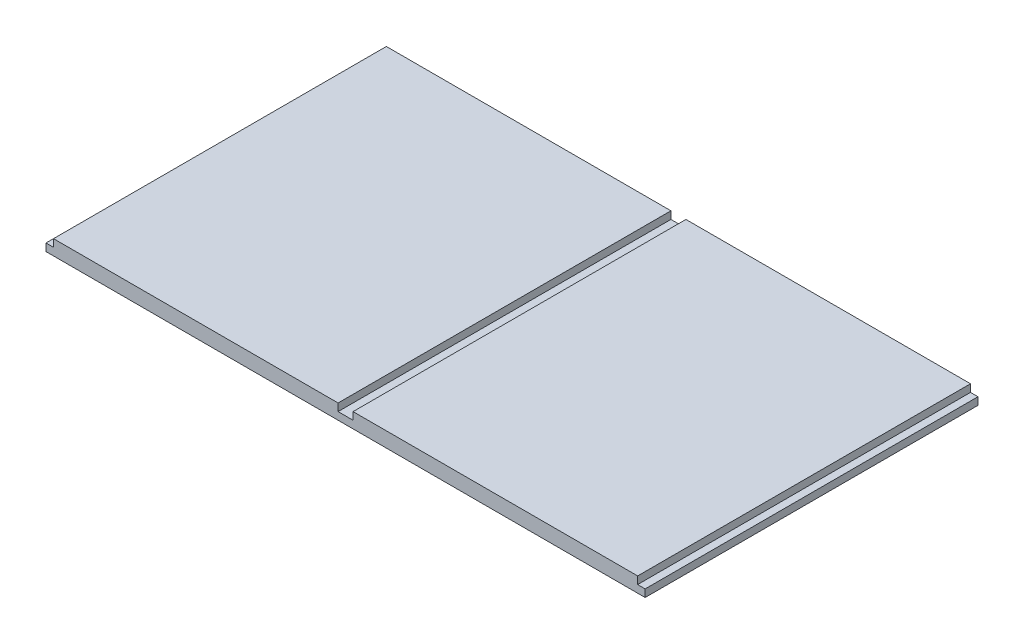
from build123d import *

# Parameters (mm, degrees)
SKETCH1_W           = 720
SKETCH1_H           = 400
BOSS_EXTRUDE1_DEPTH = 18
SKETCH2_W           = 9
SKETCH2_H           = 400
CUT_EXTRUDE1_DEPTH  = 9
SKETCH3_W           = 18
SKETCH3_H           = 400
CUT_EXTRUDE2_DEPTH  = 9


with BuildPart() as part:
    # Sketch1 → Boss-Extrude1 (new body)
    with BuildSketch(Plane(origin=(0, 0, 0), x_dir=(1, 0, 0), z_dir=(0, 1, 0))):
        Rectangle(SKETCH1_W, SKETCH1_H)
    extrude(amount=BOSS_EXTRUDE1_DEPTH)

    # Sketch2 → Cut-Extrude1 (cut)
    with BuildSketch(Plane(origin=(0, 18, 0), x_dir=(1, 0, 0), z_dir=(0, 1, 0))):
        with Locations((355.5, 0)):
            Rectangle(SKETCH2_W, SKETCH2_H)
        with Locations((-355.5, 0)):
            Rectangle(SKETCH2_W, SKETCH2_H)
    extrude(amount=-CUT_EXTRUDE1_DEPTH, mode=Mode.SUBTRACT)

    # Sketch3 → Cut-Extrude2 (cut)
    with BuildSketch(Plane(origin=(0, 18, 0), x_dir=(1, 0, 0), z_dir=(0, 1, 0))):
        Rectangle(SKETCH3_W, SKETCH3_H)
    extrude(amount=-CUT_EXTRUDE2_DEPTH, mode=Mode.SUBTRACT)


solid = part.part
